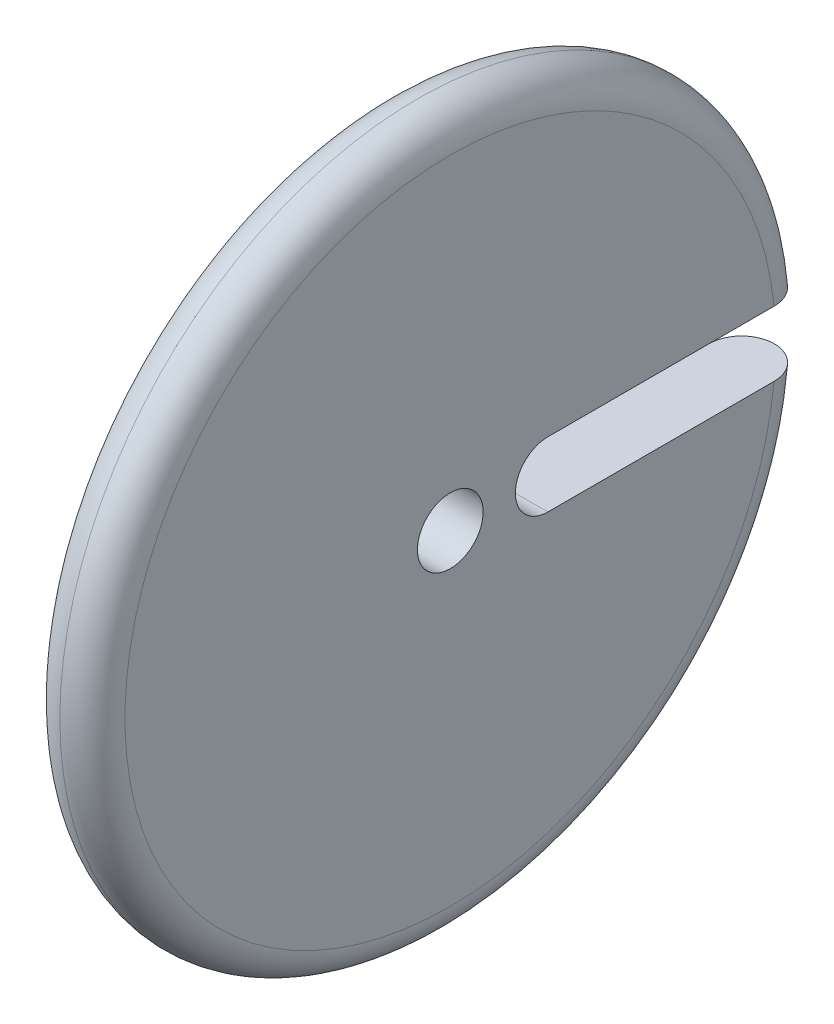
from build123d import *

# Parameters (mm, degrees)
SKETCH1_R           = 110
BOSS_EXTRUDE1_DEPTH = 20
CUT_EXTRUDE2_DEPTH  = 20
SKETCH2_R           = 10.1
CUT_EXTRUDE3_DEPTH  = 20
FILLET1_R           = 10
SCALE1_SCALE        = 0.5


with BuildPart() as part:
    # Sketch1 → Boss-Extrude1 (new body)
    with BuildSketch(Plane(origin=(0, 0, 0), x_dir=(0, 0, -1), z_dir=(1, 0, 0))):
        Circle(SKETCH1_R)
    extrude(amount=BOSS_EXTRUDE1_DEPTH)

    # Sketch3 → Cut-Extrude2 (cut)
    with BuildSketch(Plane(origin=(0, 0, 0), x_dir=(0, 0, -1), z_dir=(1, 0, 0))):
        with BuildLine():
            Line((113.492219185, -10), (30, -10))
            ThreePointArc((30, -10), (20, 0), (30, 10))
            Line((30, 10), (113.492219185, 10))
            ThreePointArc((113.492219185, 10), (123.492219185, 0), (113.492219185, -10))
        make_face()
    extrude(amount=CUT_EXTRUDE2_DEPTH, mode=Mode.SUBTRACT)

    # Sketch2 → Cut-Extrude3 (cut)
    with BuildSketch(Plane(origin=(0, 0, 0), x_dir=(0, 0, -1), z_dir=(1, 0, 0))):
        Circle(SKETCH2_R)
    extrude(amount=CUT_EXTRUDE3_DEPTH, mode=Mode.SUBTRACT)

    # Fillet1
    fillet1_edges = [part.edges().sort_by_distance(p)[0] for p in [
        (20, 0, 110),
        (0, 0, 110),
    ]]
    fillet(fillet1_edges, radius=FILLET1_R - 0.0001)  # a hair under: the kernel refuses the full size


with BuildPart() as part_1:
    # Scale1: scaled about (0, 0, 0)
    add(part.part.scale(SCALE1_SCALE))


solid = part_1.part
